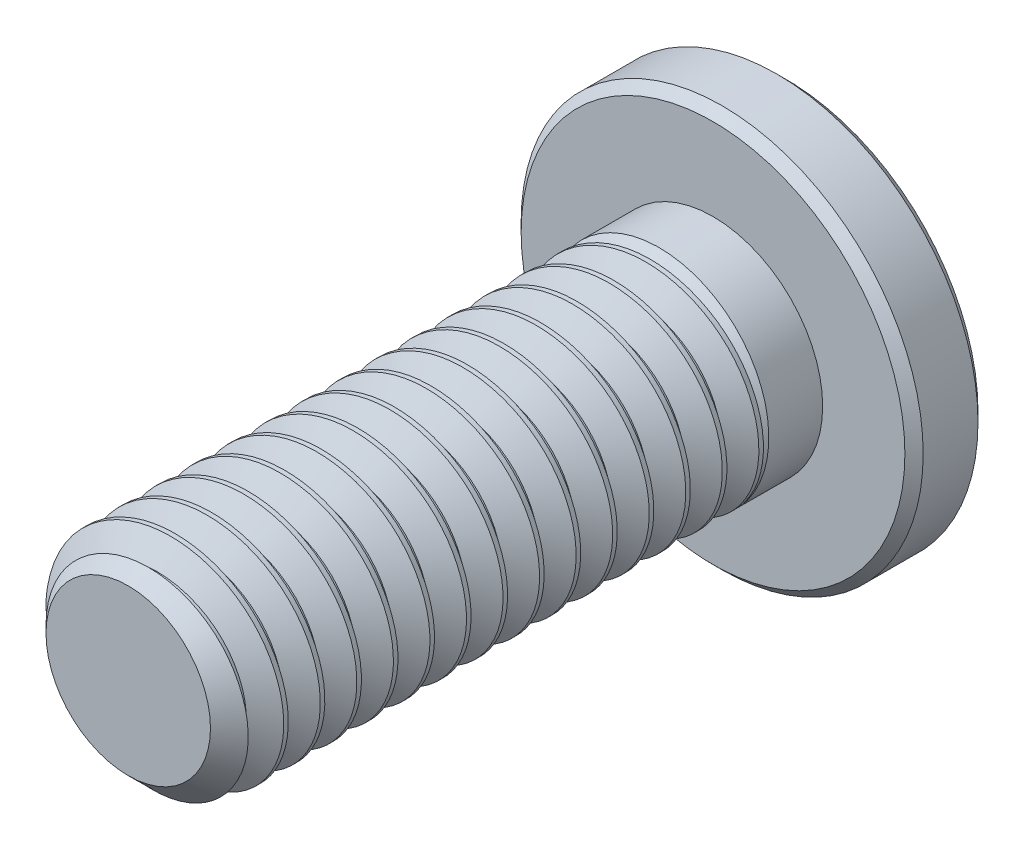
from build123d import *
from build123d.topology import SkipClean

# Parameters (mm, degrees)
EXTRUDE1_START     = -3.5
SKETCH1_R          = 1.5
EXTRUDE1_DEPTH     = 8
EXTRUDE2_START     = -4.5
SKETCH6_R          = 2.75
EXTRUDE2_DEPTH     = 1
CUT_EXTRUDE1_DEPTH = 0.75
SKETCH8_R          = 1.154700538
CUT_EXTRUDE2_DEPTH = 0.75
CUT_EXTRUDE2_TAPER = 45
CHAMFER1_SIZE      = 0.125
CHAMFER2_SIZE      = 0.375
CUT_SWEEP1_PITCH   = 0.5


# Read off the part's stored shape, not the designer's step: Split1
with BuildPart() as part:
    # Sketch1 → Extrude1 (new body)
    with BuildSketch(Plane.XY.offset(EXTRUDE1_START)):
        Circle(SKETCH1_R)
    extrude(amount=EXTRUDE1_DEPTH)

    # Sketch6 → Extrude2 (add)
    with BuildSketch(Plane.XY.offset(EXTRUDE2_START)):
        Circle(SKETCH6_R)
    extrude(amount=EXTRUDE2_DEPTH)

    # Sketch7 → Cut-Extrude1 (cut)
    with BuildSketch(Plane.XY.offset(-4.5)):
        Polygon((0, 1.154700538), (-1, 0.577350269), (-1, -0.577350269), (0, -1.154700538), (1, -0.577350269), (1, 0.577350269), align=None)
    extrude(amount=CUT_EXTRUDE1_DEPTH, mode=Mode.SUBTRACT)

    # Sketch8 → Cut-Extrude2 (cut)
    with BuildSketch(Plane.XY.offset(-4.5)):
        Circle(SKETCH8_R)
    extrude(amount=CUT_EXTRUDE2_DEPTH, taper=CUT_EXTRUDE2_TAPER, mode=Mode.SUBTRACT)

    # Chamfer1
    chamfer1_edges = [part.edges().sort_by_distance(p)[0] for p in [
        (-2.75, 0, -3.5),
        (-2.75, 0, -4.5),
    ]]
    chamfer(chamfer1_edges, length=CHAMFER1_SIZE)

    # Chamfer2
    chamfer2_edges = [part.edges().sort_by_distance(p)[0] for p in [
        (-1.5, 0, 4.5),
    ]]
    chamfer(chamfer2_edges, length=CHAMFER2_SIZE)


with BuildPart() as body_2:
    # Split1: the piece on the far side of the plane
    add(part.part)
    split(bisect_by=Plane.XY.offset(-3.5), keep=Keep.BOTTOM)


with BuildPart() as part_1:
    add(part.part)

    # Split1
    split(bisect_by=Plane.XY.offset(-3.5), keep=Keep.TOP)

    # Cut-Sweep1: the profile of Sketch3 screwed along a right-hand helix of 17 turns, 6 arcs to a turn; built about Z, then put on its axis
    cut_sweep1_z = Axis((0, 0, 0), (0, 0, 1))
    cut_sweep1_corners = [(1.175240474, 0, -0.25), (1.175240474, 0, -0.1875), (1.527063294, 0, 0.015625), (1.527063294, 0, -0.453125)]
    with BuildLine(mode=Mode.PRIVATE) as cut_sweep1_profile:
        Line(cut_sweep1_corners[0], cut_sweep1_corners[1])
        Line(cut_sweep1_corners[1], cut_sweep1_corners[2])
        Line(cut_sweep1_corners[2], cut_sweep1_corners[3])
        Line(cut_sweep1_corners[3], cut_sweep1_corners[0])
    cut_sweep1_cap = Face(cut_sweep1_profile.wire())
    cut_sweep1_turn_angles = [0, 30, 60, 90, 120, 150, 180, 210, 240, 270, 300, 330, 360]
    cut_sweep1_turn_weights = [1, 0.8660254037844387, 1, 0.8660254037844387, 1, 0.8660254037844387, 1, 0.8660254037844387, 1, 0.8660254037844387, 1, 0.8660254037844387, 1]
    cut_sweep1_turn_rails = [Edge.make_bspline([Vector(p[0], p[1], 0).rotate(cut_sweep1_z, cut_sweep1_turn_angles[k]) / cut_sweep1_turn_weights[k] + Vector(0, 0, p[2] + CUT_SWEEP1_PITCH * cut_sweep1_turn_angles[k] / 360) for k in range(13)], [0, 0, 0, 1, 1, 2, 2, 3, 3, 4, 4, 5, 5, 6, 6, 6], 2, cut_sweep1_turn_weights) for p in cut_sweep1_corners]
    cut_sweep1_turn_sides = [Face.make_surface_from_curves(cut_sweep1_turn_rails[p[0]], cut_sweep1_turn_rails[p[1]]) for p in [(0, 1), (1, 2), (2, 3), (3, 0)]]
    cut_sweep1 = Plane(origin=(0, 0, 4.5), x_dir=(0, 1, 0), z_dir=(0, 0, -1)) * Solid(Shell([*[p.moved(Location((0, 0, CUT_SWEEP1_PITCH * i))) for i in range(17) for p in cut_sweep1_turn_sides], cut_sweep1_cap, cut_sweep1_cap.rotate(cut_sweep1_z, 6120).moved(Location((0, 0, CUT_SWEEP1_PITCH * 6120 / 360)))]))
    add(cut_sweep1, mode=Mode.SUBTRACT)

    with SkipClean():  # the faces are left unmerged after this step: merging them gives an invalid solid
        add(body_2.part)  # Revolve1 merges body 2
        # Sketch9 → Revolve1 (revolve)
        with BuildSketch(Plane(origin=(0, 0, 0), x_dir=(0, 0, -1), z_dir=(1, 0, 0)), mode=Mode.PRIVATE) as revolve1_sk:
            Polygon((3.5, 1.5), (2.7634, 1.5), (2.384513886, 1.121113886), (2.384513886, 0), (3.5, 0), align=None)
        revolve(revolve1_sk.sketch.rotate(Axis((0, 0, -4.5), (0, 0, 1)), 90), axis=Axis((0, 0, -4.5), (0, 0, 1)))


solid = part_1.part
